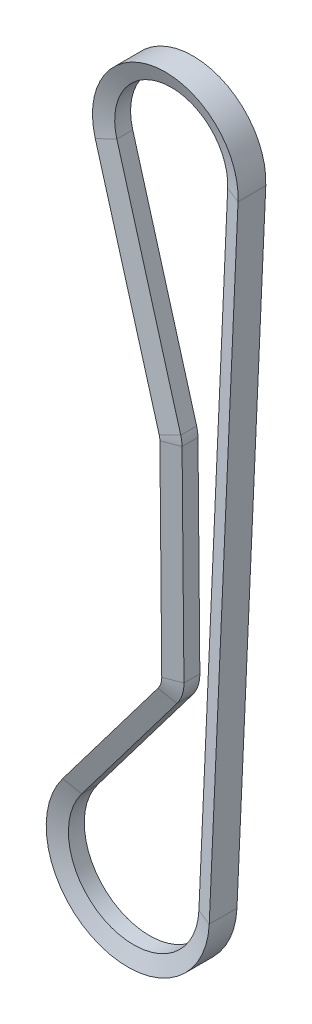
from build123d import *


with BuildPart() as part:
    # Sweep1: sweep along a path in Sketch2
    with BuildLine(Plane.XY) as sweep1_path:
        Line((24.974696906, -1.124506326), (15.079961333, -220.881404302))
        ThreePointArc((15.079961333, -220.881404302), (-22.398627452, -245.958591688), (-35.218500499, -202.724799355))
        Line((-35.218500499, -202.724799355), (-2.501890487, -159.495206731))
        ThreePointArc((-2.501890487, -159.495206731), (-1.536274952, -157.656530873), (-1.215559906, -155.604633183))
        Line((-1.215559906, -155.604633183), (-1.860877595, -85.607607781))
        ThreePointArc((-1.860877595, -85.607607781), (-1.925664053, -84.759514731), (-2.10321385, -83.927688321))
        Line((-2.10321385, -83.927688321), (-24.044857899, -6.844326745))
        ThreePointArc((-24.044857899, -6.844326745), (-2.89745346, 24.83152761), (24.974696906, -1.124506326))
    # Sketch3 → Sweep1 (sweep)
    with BuildSketch(Plane(origin=(-24.044857899, -6.844326745, 0), x_dir=(0.961794315978821, 0.27377306980569105, 0), z_dir=(-0.27377306980569105, 0.961794315978821, 0))):
        Polygon((0, -4.7625), (0, 4.7625), (5.588, 2.728634331), (5.588, -2.728634331), align=None)
    sweep(path=sweep1_path.line)


solid = part.part
